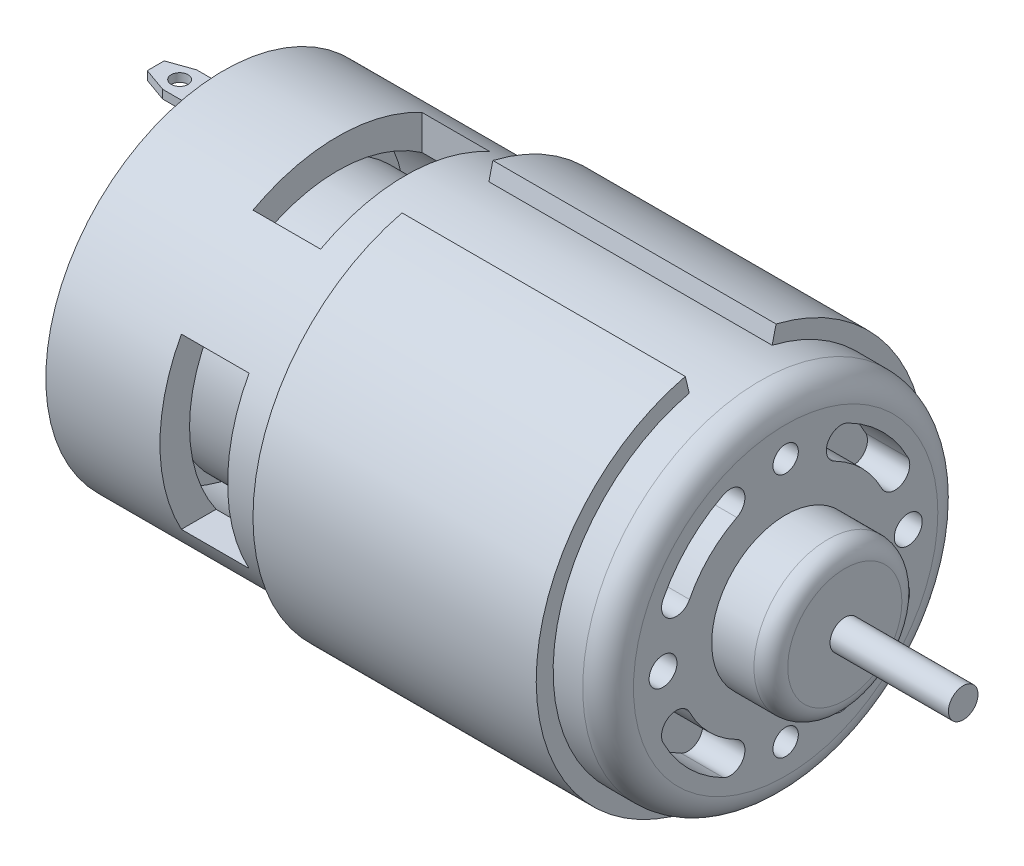
from build123d import *
from OCP.BRepFilletAPI import BRepFilletAPI_MakeChamfer

# Parameters (mm, degrees)
SKETCH1_R               = 21
BOSS_EXTRUDE1_DEPTH     = 66.5
FILLET1_R               = 3
SKETCH2_R               = 8.75
BOSS_EXTRUDE2_DEPTH     = 7
FILLET2_R               = 2
SKETCH3_R               = 1.75
BOSS_EXTRUDE3_DEPTH     = 14
BOSS_EXTRUDE4_START     = -33.5
BOSS_EXTRUDE4_DEPTH     = 33.5
SKETCH5_R               = 19
SKETCH5_W               = 4
SKETCH5_H               = 1
CUT_EXTRUDE1_DEPTH      = 2
SKETCH5_3_W             = 4
SKETCH5_3_H             = 1
BOSS_EXTRUDE5_DEPTH     = 8
CUT_EXTRUDE2_DEPTH      = 37
SKETCH7_W               = 8
SKETCH7_H               = 20
CUT_EXTRUDE3_DEPTH      = 101.604423362
CIRPATTERN1_COUNT       = 2
CIRPATTERN1_ANGLE       = 90
SKETCH9_R               = 17.5
BOSS_EXTRUDE6_DEPTH     = 64.5
CUT_EXTRUDE4_DEPTH      = 100.123660142
CUT_EXTRUDE4_DEPTH_BACK = 100.123660142
SKETCH10_R              = 1
M4_TAPPED_HOLE1_D       = 3.3
M4_TAPPED_HOLE1_DEPTH   = 10.1
M4_TAPPED_HOLE1_TIP     = 0.991420021
SKETCH11_R              = 1.5
CUT_EXTRUDE6_DEPTH      = 5
SKETCH13_R              = 15
BOSS_EXTRUDE7_DEPTH     = 1
CHAMFER1_SIZE           = 2
CHAMFER1_SIZE_2         = 3.5
SKETCH15_W              = 6
SKETCH15_H              = 5
BOSS_EXTRUDE8_DEPTH     = 1
CHAMFER2_SIZE           = 1
CHAMFER2_SIZE_2         = 0.624869352
SKETCH17_R              = 6.184929539
BOSS_EXTRUDE9_DEPTH     = 3
FILLET3_R               = 1
SKETCH19_R              = 2
BOSS_EXTRUDE10_DEPTH    = 3
FILLET4_R               = 1
CUT_EXTRUDE7_DEPTH      = 5
CUT_EXTRUDE8_START      = -26
SKETCH22_R              = 17.5
SKETCH22_R_2            = 15
CUT_EXTRUDE8_DEPTH      = 26
SKETCH23_R              = 17.5
SKETCH23_R_2            = 6
CUT_EXTRUDE9_DEPTH      = 5


# Some blends are built 0.0001 mm under size
with BuildPart() as part:
    # Sketch1 → Boss-Extrude1 (new body)
    with BuildSketch(Plane(origin=(0, 0, 0), x_dir=(0, 0, -1), z_dir=(1, 0, 0))):
        Circle(SKETCH1_R)
    extrude(amount=BOSS_EXTRUDE1_DEPTH)

    # Fillet1
    fillet1_edges = [part.edges().sort_by_distance(p)[0] for p in [
        (66.5, 0, 21),
    ]]
    fillet(fillet1_edges, radius=FILLET1_R)

    # Sketch2 → Boss-Extrude2 (add)
    with BuildSketch(Plane(origin=(66.5, 0, 0), x_dir=(0, 0, -1), z_dir=(1, 0, 0))):
        Circle(SKETCH2_R)
    extrude(amount=BOSS_EXTRUDE2_DEPTH)

    # Fillet2
    fillet2_edges = [part.edges().sort_by_distance(p)[0] for p in [
        (73.5, 0, 8.75),
    ]]
    fillet(fillet2_edges, radius=FILLET2_R)

    # Sketch3 → Boss-Extrude3 (add)
    with BuildSketch(Plane(origin=(73.5, 0, 0), x_dir=(0, 0, -1), z_dir=(1, 0, 0))):
        Circle(SKETCH3_R)
    extrude(amount=BOSS_EXTRUDE3_DEPTH)

    # Sketch4 → Boss-Extrude4 (add)
    with BuildSketch(Plane(origin=(60, 0, 0), x_dir=(0, 0, -1), z_dir=(1, 0, 0)).offset(BOSS_EXTRUDE4_START)):
        with BuildLine():
            Line((-4.902500441, 20.419732844), (-5.369405245, 22.364469305))
            ThreePointArc((-5.369405245, 22.364469305), (-14.239095466, -18.062340942), (23, 0))
            ThreePointArc((23, 0), (18.062340942, 14.239095466), (5.369405245, 22.364469305))
            Line((5.369405245, 22.364469305), (4.902500441, 20.419732844))
            ThreePointArc((4.902500441, 20.419732844), (16.491702599, 13.000913251), (21, 0))
            ThreePointArc((21, 0), (-13.000913251, -16.491702599), (-4.902500441, 20.419732844))
        make_face()
    extrude(amount=BOSS_EXTRUDE4_DEPTH)

    # Sketch5 → Cut-Extrude1 (cut)
    with BuildSketch(Plane.ZY):
        Circle(SKETCH5_R)
        with Locations((0, 17)):
            Rectangle(SKETCH5_W, SKETCH5_H, mode=Mode.SUBTRACT)
        with Locations((0, -17)):
            Rectangle(SKETCH5_W, SKETCH5_H, mode=Mode.SUBTRACT)
    extrude(amount=-CUT_EXTRUDE1_DEPTH, mode=Mode.SUBTRACT)

    # Sketch5<3> → Boss-Extrude5 (add)
    with BuildSketch(Plane.ZY):
        with Locations((0, 17)):
            Rectangle(SKETCH5_3_W, SKETCH5_3_H)
        with Locations((0, -17)):
            Rectangle(SKETCH5_3_W, SKETCH5_3_H)
    extrude(amount=BOSS_EXTRUDE5_DEPTH)

    # Sketch6 → Cut-Extrude2 (cut)
    with BuildSketch(Plane.XZ.offset(17.5)):
        Polygon((-8, -2), (-5.171572875, -2), (-8, -1), align=None)
        Polygon((-8, 2), (-8, 1), (-5.171572875, 2), align=None)
    extrude(amount=-CUT_EXTRUDE2_DEPTH, mode=Mode.SUBTRACT)

    # Sketch7 → Cut-Extrude3 (cut, through all)
    with BuildSketch(Plane(origin=(0, 21, 0), x_dir=(1, 0, 0), z_dir=(0, 1, 0))):
        with Locations((17.5, 0)):
            Rectangle(SKETCH7_W, SKETCH7_H)
    cut_extrude3 = extrude(amount=-CUT_EXTRUDE3_DEPTH, mode=Mode.SUBTRACT)

    # CirPattern1: Cut-Extrude3 ×2 about axis
    cirpattern1_axis = Axis((0, 0, 0), (-1, 0, 0))
    for i in range(1, CIRPATTERN1_COUNT):
        add(cut_extrude3.rotate(cirpattern1_axis, i * CIRPATTERN1_ANGLE / (CIRPATTERN1_COUNT - 1)), mode=Mode.SUBTRACT)

    # Sketch9 → Boss-Extrude6 (add)
    with BuildSketch(Plane.ZY.offset(-2)):
        Circle(SKETCH9_R)
    extrude(amount=-BOSS_EXTRUDE6_DEPTH)

    # Sketch10 → Cut-Extrude4 (cut, two sides: drawn at the far end of the back side and taken through both)
    with BuildSketch(Plane(origin=(0, 17.5, 0), x_dir=(1, 0, 0), z_dir=(0, 1, 0)).offset(-CUT_EXTRUDE4_DEPTH_BACK)):
        with Locations(Location((-5.171572875, 0, 0), (0, 0, 270))):
            Circle(SKETCH10_R)
    extrude(amount=CUT_EXTRUDE4_DEPTH + CUT_EXTRUDE4_DEPTH_BACK, mode=Mode.SUBTRACT)

    # M4 Tapped Hole1
    with Locations(Plane(origin=(66.5, 0, 14.5), x_dir=(0, 0, 1), z_dir=(1, 0, 0))):
        with Locations((0, 0), (-29, 0)):
            Hole(M4_TAPPED_HOLE1_D / 2, depth=M4_TAPPED_HOLE1_DEPTH)
            with Locations((0, 0, -(M4_TAPPED_HOLE1_DEPTH + M4_TAPPED_HOLE1_TIP / 2))):  # 118° drill point
                Cone(0, M4_TAPPED_HOLE1_D / 2, M4_TAPPED_HOLE1_TIP, mode=Mode.SUBTRACT)

    # Sketch11 → Cut-Extrude6 (cut)
    with BuildSketch(Plane(origin=(66.5, 0, 0), x_dir=(0, 0, -1), z_dir=(1, 0, 0))):
        with Locations((0, -14.5)):
            Circle(SKETCH11_R)
        with Locations((0, 14.5)):
            Circle(SKETCH11_R)
        with BuildLine():
            ThreePointArc((-7.357118947, 14.48914424), (-11.490485194, 11.490485194), (-14.48914424, 7.357118947))
            ThreePointArc((-14.48914424, 7.357118947), (-13.721079977, 5.00444445), (-11.36840548, 5.772508712))
            ThreePointArc((-11.36840548, 5.772508712), (-9.01561146, 9.01561146), (-5.772508712, 11.36840548))
            ThreePointArc((-5.772508712, 11.36840548), (-5.00444445, 13.721079977), (-7.357118947, 14.48914424))
        make_face()
        with BuildLine():
            ThreePointArc((14.48914424, 7.357118947), (11.490485194, 11.490485194), (7.357118947, 14.48914424))
            ThreePointArc((7.357118947, 14.48914424), (5.00444445, 13.721079977), (5.772508712, 11.36840548))
            ThreePointArc((5.772508712, 11.36840548), (9.01561146, 9.01561146), (11.36840548, 5.772508712))
            ThreePointArc((11.36840548, 5.772508712), (13.721079977, 5.00444445), (14.48914424, 7.357118947))
        make_face()
        with BuildLine():
            ThreePointArc((7.357118947, -14.48914424), (11.490485194, -11.490485194), (14.48914424, -7.357118947))
            ThreePointArc((14.48914424, -7.357118947), (13.721079977, -5.00444445), (11.36840548, -5.772508712))
            ThreePointArc((11.36840548, -5.772508712), (9.01561146, -9.01561146), (5.772508712, -11.36840548))
            ThreePointArc((5.772508712, -11.36840548), (5.00444445, -13.721079977), (7.357118947, -14.48914424))
        make_face()
        with BuildLine():
            ThreePointArc((-14.48914424, -7.357118947), (-11.490485194, -11.490485194), (-7.357118947, -14.48914424))
            ThreePointArc((-7.357118947, -14.48914424), (-5.00444445, -13.721079977), (-5.772508712, -11.36840548))
            ThreePointArc((-5.772508712, -11.36840548), (-9.01561146, -9.01561146), (-11.36840548, -5.772508712))
            ThreePointArc((-11.36840548, -5.772508712), (-13.721079977, -5.00444445), (-14.48914424, -7.357118947))
        make_face()
    extrude(amount=-CUT_EXTRUDE6_DEPTH, mode=Mode.SUBTRACT)

    # Sketch13 → Boss-Extrude7 (add)
    with BuildSketch(Plane.ZY.offset(-2)):
        Circle(SKETCH13_R)
    extrude(amount=BOSS_EXTRUDE7_DEPTH)

    # Chamfer1
    # the kernel refuses this chamfer: 3.5, 2 mm, written as the material it takes off along each edge
    with BuildSketch(Plane(origin=(1, 0, 0), x_dir=(0, 0, 1), z_dir=(0, -1, 0))) as chamfer1_piece_1_section:
        Polygon((15, -CHAMFER1_SIZE), (15 - CHAMFER1_SIZE_2, 0), (15, 0), align=None)
    chamfer1_piece_1 = revolve(axis=Axis((1, 0, 0), (-1, 0, 0)), mode=Mode.PRIVATE)
    chamfer1_piece_1 = split(chamfer1_piece_1, bisect_by=Plane(origin=(2, 0, -12.345664859), z_dir=(-1, 0, 0)), keep=Keep.TOP, mode=Mode.PRIVATE)
    add(chamfer1_piece_1, mode=Mode.SUBTRACT)

    # Sketch15 → Boss-Extrude8 (add)
    with BuildSketch(Plane.ZY.offset(-2)):
        with Locations((0, 17)):
            Rectangle(SKETCH15_W, SKETCH15_H)
        with Locations((0, -17)):
            Rectangle(SKETCH15_W, SKETCH15_H)
    extrude(amount=BOSS_EXTRUDE8_DEPTH)

    # Chamfer2
    chamfer2_edges_1 = [part.edges().sort_by_distance(p)[0] for p in [
        (1, 16.63083152, 3),
    ]]
    chamfer2_side_1 = [part.faces().sort_by_distance(p)[0] for p in [
        (1, 16.63083152, 2.987502613),
    ]]
    chamfer2_edges_2 = [part.edges().sort_by_distance(p)[0] for p in [
        (1, 16.63083152, -3),
    ]]
    chamfer2_side_2 = [part.faces().sort_by_distance(p)[0] for p in [
        (1.012497387, 16.63083152, -3),
    ]]
    chamfer2_edges_3 = [part.edges().sort_by_distance(p)[0] for p in [
        (1, 14.5, 0),
    ]]
    chamfer2_side_3 = [part.faces().sort_by_distance(p)[0] for p in [
        (1, 14.512497387, 0),
    ]]
    chamfer2_edges_4 = [part.edges().sort_by_distance(p)[0] for p in [
        (1, -16.63083152, -3),
    ]]
    chamfer2_side_4 = [part.faces().sort_by_distance(p)[0] for p in [
        (1, -16.63083152, -2.987502613),
    ]]
    chamfer2_edges_5 = [part.edges().sort_by_distance(p)[0] for p in [
        (1, -16.63083152, 3),
    ]]
    chamfer2_side_5 = [part.faces().sort_by_distance(p)[0] for p in [
        (1.012497387, -16.63083152, 3),
    ]]
    chamfer2_edges_6 = [part.edges().sort_by_distance(p)[0] for p in [
        (1, -14.5, 0),
    ]]
    chamfer2_side_6 = [part.faces().sort_by_distance(p)[0] for p in [
        (1, -14.512497387, 0),
    ]]
    chamfer2 = BRepFilletAPI_MakeChamfer(part.part.solid().wrapped)
    for e in chamfer2_edges_1:
        chamfer2.Add(CHAMFER2_SIZE - 0.0001, CHAMFER2_SIZE_2 - 0.0001, e.wrapped, chamfer2_side_1[0].wrapped)
    for e in chamfer2_edges_2:
        chamfer2.Add(CHAMFER2_SIZE_2 - 0.0001, CHAMFER2_SIZE - 0.0001, e.wrapped, chamfer2_side_2[0].wrapped)
    for e in chamfer2_edges_3:
        chamfer2.Add(CHAMFER2_SIZE - 0.0001, CHAMFER2_SIZE_2 - 0.0001, e.wrapped, chamfer2_side_3[0].wrapped)
    for e in chamfer2_edges_4:
        chamfer2.Add(CHAMFER2_SIZE - 0.0001, CHAMFER2_SIZE_2 - 0.0001, e.wrapped, chamfer2_side_4[0].wrapped)
    for e in chamfer2_edges_5:
        chamfer2.Add(CHAMFER2_SIZE_2 - 0.0001, CHAMFER2_SIZE - 0.0001, e.wrapped, chamfer2_side_5[0].wrapped)
    for e in chamfer2_edges_6:
        chamfer2.Add(CHAMFER2_SIZE - 0.0001, CHAMFER2_SIZE_2 - 0.0001, e.wrapped, chamfer2_side_6[0].wrapped)
    add(Compound.cast(chamfer2.Shape()), mode=Mode.REPLACE)  # a hair under: the kernel refuses the full size

    # Sketch17 → Boss-Extrude9 (add)
    with BuildSketch(Plane.ZY.offset(-1)):
        Circle(SKETCH17_R)
    extrude(amount=BOSS_EXTRUDE9_DEPTH)

    # Fillet3
    fillet3_edges = [part.edges().sort_by_distance(p)[0] for p in [
        (-2, 0, -6.184929539),
    ]]
    fillet(fillet3_edges, radius=FILLET3_R)

    # Sketch19 → Boss-Extrude10 (add)
    with BuildSketch(Plane.ZY.offset(2)):
        Circle(SKETCH19_R)
    extrude(amount=BOSS_EXTRUDE10_DEPTH)

    # Fillet4
    fillet4_edges = [part.edges().sort_by_distance(p)[0] for p in [
        (-5, 0, -2),
    ]]
    fillet(fillet4_edges, radius=FILLET4_R)

    # Sketch20 → Cut-Extrude7 (cut)
    with BuildSketch(Plane.ZY.offset(-1)):
        with BuildLine():
            ThreePointArc((-8.502595121, -2.950572184), (-6.363961031, -6.363961031), (-2.950572184, -8.502595121))
            ThreePointArc((-2.950572184, -8.502595121), (-2.924737516, -7.586524384), (-3.530709504, -6.899028221))
            ThreePointArc((-3.530709504, -6.899028221), (-5.480077554, -5.480077554), (-6.899028221, -3.530709504))
            ThreePointArc((-6.899028221, -3.530709504), (-7.586524384, -2.924737516), (-8.502595121, -2.950572184))
        make_face()
        with BuildLine():
            ThreePointArc((-4.669648054, -9.124521196), (-3.674928455, -9.187215971), (-2.950572184, -8.502595121))
            ThreePointArc((-2.950572184, -8.502595121), (-6.363961031, -6.363961031), (-8.502595121, -2.950572184))
            ThreePointArc((-8.502595121, -2.950572184), (-9.187215971, -3.674928455), (-9.124521196, -4.669648054))
            ThreePointArc((-9.124521196, -4.669648054), (-7.247844507, -7.247844507), (-4.669648054, -9.124521196))
        make_face()
        with BuildLine():
            ThreePointArc((-3.530709504, 6.899028221), (-2.924737516, 7.586524384), (-2.950572184, 8.502595121))
            ThreePointArc((-2.950572184, 8.502595121), (-6.363961031, 6.363961031), (-8.502595121, 2.950572184))
            ThreePointArc((-8.502595121, 2.950572184), (-7.586524384, 2.924737516), (-6.899028221, 3.530709504))
            ThreePointArc((-6.899028221, 3.530709504), (-5.480077554, 5.480077554), (-3.530709504, 6.899028221))
        make_face()
        with BuildLine():
            ThreePointArc((-8.502595121, 2.950572184), (-6.363961031, 6.363961031), (-2.950572184, 8.502595121))
            ThreePointArc((-2.950572184, 8.502595121), (-3.674928455, 9.187215971), (-4.669648054, 9.124521196))
            ThreePointArc((-4.669648054, 9.124521196), (-7.247844507, 7.247844507), (-9.124521196, 4.669648054))
            ThreePointArc((-9.124521196, 4.669648054), (-9.187215971, 3.674928455), (-8.502595121, 2.950572184))
        make_face()
        with BuildLine():
            ThreePointArc((6.899028221, 3.530709504), (7.586524384, 2.924737516), (8.502595121, 2.950572184))
            ThreePointArc((8.502595121, 2.950572184), (6.363961031, 6.363961031), (2.950572184, 8.502595121))
            ThreePointArc((2.950572184, 8.502595121), (2.924737516, 7.586524384), (3.530709504, 6.899028221))
            ThreePointArc((3.530709504, 6.899028221), (5.480077554, 5.480077554), (6.899028221, 3.530709504))
        make_face()
        with BuildLine():
            ThreePointArc((2.950572184, 8.502595121), (6.363961031, 6.363961031), (8.502595121, 2.950572184))
            ThreePointArc((8.502595121, 2.950572184), (9.187215971, 3.674928455), (9.124521196, 4.669648054))
            ThreePointArc((9.124521196, 4.669648054), (7.247844507, 7.247844507), (4.669648054, 9.124521196))
            ThreePointArc((4.669648054, 9.124521196), (3.674928455, 9.187215971), (2.950572184, 8.502595121))
        make_face()
        with BuildLine():
            ThreePointArc((2.950572184, -8.502595121), (6.363961031, -6.363961031), (8.502595121, -2.950572184))
            ThreePointArc((8.502595121, -2.950572184), (7.586524384, -2.924737516), (6.899028221, -3.530709504))
            ThreePointArc((6.899028221, -3.530709504), (5.480077554, -5.480077554), (3.530709504, -6.899028221))
            ThreePointArc((3.530709504, -6.899028221), (2.924737516, -7.586524384), (2.950572184, -8.502595121))
        make_face()
        with BuildLine():
            ThreePointArc((9.124521196, -4.669648054), (9.187215971, -3.674928455), (8.502595121, -2.950572184))
            ThreePointArc((8.502595121, -2.950572184), (6.363961031, -6.363961031), (2.950572184, -8.502595121))
            ThreePointArc((2.950572184, -8.502595121), (3.674928455, -9.187215971), (4.669648054, -9.124521196))
            ThreePointArc((4.669648054, -9.124521196), (7.247844507, -7.247844507), (9.124521196, -4.669648054))
        make_face()
    extrude(amount=-CUT_EXTRUDE7_DEPTH, mode=Mode.SUBTRACT)

    # Sketch22 → Cut-Extrude8 (cut)
    with BuildSketch(Plane(origin=(30, 0, 0), x_dir=(0, 0, -1), z_dir=(1, 0, 0)).offset(CUT_EXTRUDE8_START)):
        Circle(SKETCH22_R)
        Circle(SKETCH22_R_2, mode=Mode.SUBTRACT)
    extrude(amount=CUT_EXTRUDE8_DEPTH, mode=Mode.SUBTRACT)

    # Sketch23 → Cut-Extrude9 (cut)
    with BuildSketch(Plane(origin=(4, 0, 0), x_dir=(0, 0, -1), z_dir=(1, 0, 0))):
        Circle(SKETCH23_R)
        Circle(SKETCH23_R_2, mode=Mode.SUBTRACT)
    extrude(amount=CUT_EXTRUDE9_DEPTH, mode=Mode.SUBTRACT)


solid = part.part
